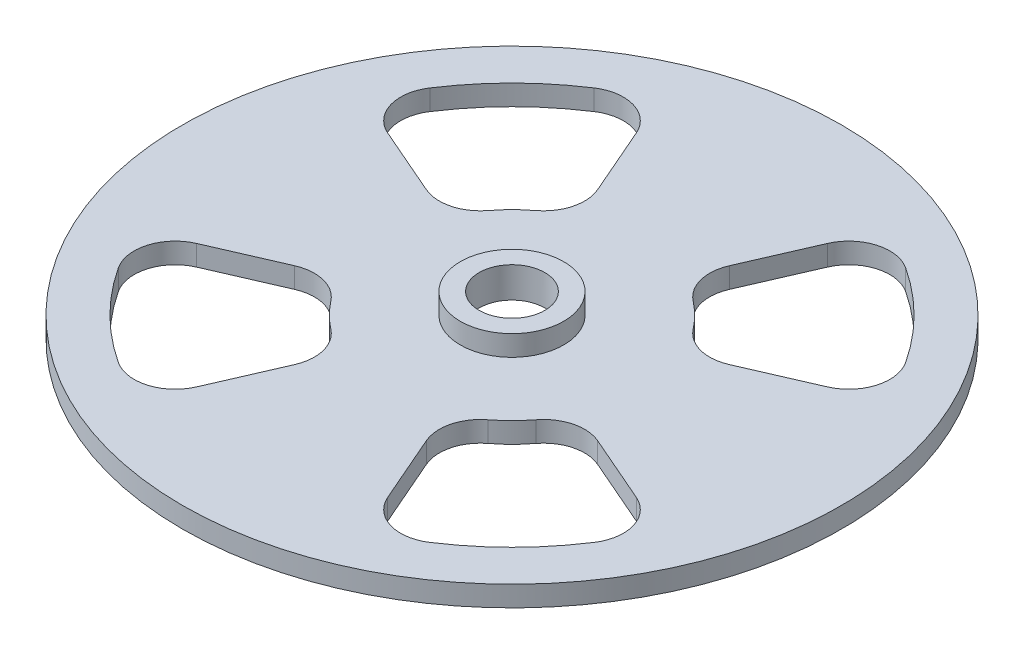
from build123d import *

# Parameters (mm, degrees)
SKETCH1_R           = 25.5
BOSS_EXTRUDE1_DEPTH = 1.5875
CUT_EXTRUDE1_REACH  = 38.097
SKETCH3_R           = 4
BOSS_EXTRUDE2_DEPTH = 1.5875
CUT_EXTRUDE2_REACH  = 38.202
SKETCH4_R           = 2.54
SKETCH5_R           = 6
CUT_EXTRUDE3_DEPTH  = 0.8


with BuildPart() as part:
    # Sketch1 → Boss-Extrude1 (new body)
    with BuildSketch(Plane(origin=(0, 0, 0), x_dir=(1, 0, 0), z_dir=(0, 1, 0))):
        Circle(SKETCH1_R)
    extrude(amount=BOSS_EXTRUDE1_DEPTH)

    # Sketch2 → Cut-Extrude1 (cut, up to next)
    with BuildSketch(Plane(origin=(0, 1.5875, 0), x_dir=(1, 0, 0), z_dir=(0, 1, 0)), mode=Mode.PRIVATE) as cut_extrude1_sk1:
        with BuildLine():
            Line((5.098689446, 11.726182923), (7.398917645, 17.016345603))
            ThreePointArc((7.398917645, 17.016345603), (9.401129193, 18.792276888), (12.049552955, 18.406745328))
            ThreePointArc((12.049552955, 18.406745328), (15.556349186, 15.556349186), (18.406745328, 12.049552955))
            ThreePointArc((18.406745328, 12.049552955), (18.792276888, 9.401129193), (17.016345603, 7.398917645))
            Line((17.016345603, 7.398917645), (11.726182923, 5.098689446))
            ThreePointArc((11.726182923, 5.098689446), (9.663717077, 4.936869827), (7.939396303, 6.079965983))
            ThreePointArc((7.939396303, 6.079965983), (7.071067812, 7.071067812), (6.079965983, 7.939396303))
            ThreePointArc((6.079965983, 7.939396303), (4.936869827, 9.663717077), (5.098689446, 11.726182923))
        make_face()
    cut_extrude1_tool1 = extrude(cut_extrude1_sk1.sketch, amount=-CUT_EXTRUDE1_REACH, mode=Mode.PRIVATE) & part.part
    # Sketch2 → Cut-Extrude1 (cut, up to next)
    with BuildSketch(Plane(origin=(0, 1.5875, 0), x_dir=(1, 0, 0), z_dir=(0, 1, 0)), mode=Mode.PRIVATE) as cut_extrude1_sk2:
        with BuildLine():
            Line((-11.726182923, 5.098689446), (-17.016345603, 7.398917645))
            ThreePointArc((-17.016345603, 7.398917645), (-18.792276888, 9.401129193), (-18.406745328, 12.049552955))
            ThreePointArc((-18.406745328, 12.049552955), (-15.556349186, 15.556349186), (-12.049552955, 18.406745328))
            ThreePointArc((-12.049552955, 18.406745328), (-9.401129193, 18.792276888), (-7.398917645, 17.016345603))
            Line((-7.398917645, 17.016345603), (-5.098689446, 11.726182923))
            ThreePointArc((-5.098689446, 11.726182923), (-4.936869827, 9.663717077), (-6.079965983, 7.939396303))
            ThreePointArc((-6.079965983, 7.939396303), (-7.071067812, 7.071067812), (-7.939396303, 6.079965983))
            ThreePointArc((-7.939396303, 6.079965983), (-9.663717077, 4.936869827), (-11.726182923, 5.098689446))
        make_face()
    cut_extrude1_tool2 = extrude(cut_extrude1_sk2.sketch, amount=-CUT_EXTRUDE1_REACH, mode=Mode.PRIVATE) & part.part
    # Sketch2 → Cut-Extrude1 (cut, up to next)
    with BuildSketch(Plane(origin=(0, 1.5875, 0), x_dir=(1, 0, 0), z_dir=(0, 1, 0)), mode=Mode.PRIVATE) as cut_extrude1_sk3:
        with BuildLine():
            Line((-11.726182923, -5.098689446), (-17.016345603, -7.398917645))
            ThreePointArc((-17.016345603, -7.398917645), (-18.792276888, -9.401129193), (-18.406745328, -12.049552955))
            ThreePointArc((-18.406745328, -12.049552955), (-15.556349186, -15.556349186), (-12.049552955, -18.406745328))
            ThreePointArc((-12.049552955, -18.406745328), (-9.401129193, -18.792276888), (-7.398917645, -17.016345603))
            Line((-7.398917645, -17.016345603), (-5.098689446, -11.726182923))
            ThreePointArc((-5.098689446, -11.726182923), (-4.936869827, -9.663717077), (-6.079965983, -7.939396303))
            ThreePointArc((-6.079965983, -7.939396303), (-7.071067812, -7.071067812), (-7.939396303, -6.079965983))
            ThreePointArc((-7.939396303, -6.079965983), (-9.663717077, -4.936869827), (-11.726182923, -5.098689446))
        make_face()
    cut_extrude1_tool3 = extrude(cut_extrude1_sk3.sketch, amount=-CUT_EXTRUDE1_REACH, mode=Mode.PRIVATE) & part.part
    # Sketch2 → Cut-Extrude1 (cut, up to next)
    with BuildSketch(Plane(origin=(0, 1.5875, 0), x_dir=(1, 0, 0), z_dir=(0, 1, 0)), mode=Mode.PRIVATE) as cut_extrude1_sk4:
        with BuildLine():
            Line((11.726182923, -5.098689446), (17.016345603, -7.398917645))
            ThreePointArc((17.016345603, -7.398917645), (18.792276888, -9.401129193), (18.406745328, -12.049552955))
            ThreePointArc((18.406745328, -12.049552955), (15.556349186, -15.556349186), (12.049552955, -18.406745328))
            ThreePointArc((12.049552955, -18.406745328), (9.401129193, -18.792276888), (7.398917645, -17.016345603))
            Line((7.398917645, -17.016345603), (5.098689446, -11.726182923))
            ThreePointArc((5.098689446, -11.726182923), (4.936869827, -9.663717077), (6.079965983, -7.939396303))
            ThreePointArc((6.079965983, -7.939396303), (7.071067812, -7.071067812), (7.939396303, -6.079965983))
            ThreePointArc((7.939396303, -6.079965983), (9.663717077, -4.936869827), (11.726182923, -5.098689446))
        make_face()
    cut_extrude1_tool4 = extrude(cut_extrude1_sk4.sketch, amount=-CUT_EXTRUDE1_REACH, mode=Mode.PRIVATE) & part.part
    add(cut_extrude1_tool1.solids().sort_by_distance((11.555905, 1.5875, -11.555905))[0], mode=Mode.SUBTRACT)
    add(cut_extrude1_tool2.solids().sort_by_distance((-11.555905, 1.5875, -11.555905))[0], mode=Mode.SUBTRACT)
    add(cut_extrude1_tool3.solids().sort_by_distance((-11.555905, 1.5875, 11.555905))[0], mode=Mode.SUBTRACT)
    add(cut_extrude1_tool4.solids().sort_by_distance((11.555905, 1.5875, 11.555905))[0], mode=Mode.SUBTRACT)

    # Sketch3 → Boss-Extrude2 (add)
    with BuildSketch(Plane(origin=(0, 1.5875, 0), x_dir=(1, 0, 0), z_dir=(0, 1, 0))):
        Circle(SKETCH3_R)
    extrude(amount=BOSS_EXTRUDE2_DEPTH)

    # Sketch4 → Cut-Extrude2 (cut, up to next)
    with BuildSketch(Plane(origin=(0, 3.175, 0), x_dir=(1, 0, 0), z_dir=(0, 1, 0)), mode=Mode.PRIVATE) as cut_extrude2_sk1:
        Circle(SKETCH4_R)
    cut_extrude2_tool1 = extrude(cut_extrude2_sk1.sketch, amount=-CUT_EXTRUDE2_REACH, mode=Mode.PRIVATE) & part.part
    add(cut_extrude2_tool1.solids().sort_by_distance((0, 3.175, 0))[0], mode=Mode.SUBTRACT)

    # Sketch5 → Cut-Extrude3 (cut)
    with BuildSketch(Plane.XZ):
        Circle(SKETCH5_R)
    extrude(amount=-CUT_EXTRUDE3_DEPTH, mode=Mode.SUBTRACT)


solid = part.part
